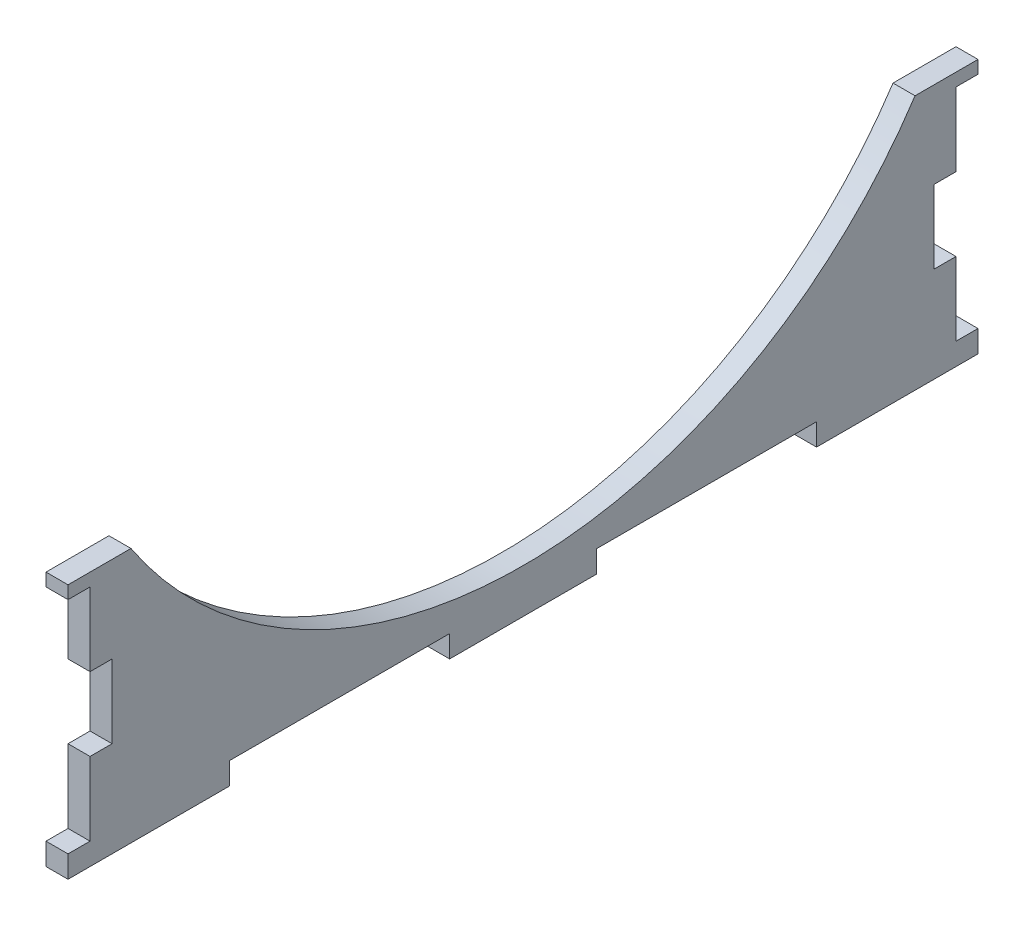
from build123d import *

# Parameters (mm, degrees)
IMPORTED_START          = -3
IMPORTED_BODY_4_1_DEPTH = 3
CUT_EXTRUDE_2_DEPTH     = 3


# Read off the part's stored shape, not the designer's step: 基体零件-零件4-1
with BuildPart() as part:
    # 基体零件-零件4-1 outline → 基体零件-零件4-1 (new body)
    with BuildSketch(Plane.YZ.offset(IMPORTED_START)):
        Polygon((-3, -3), (0, -3), (0, 0), (9.999598957, 0), (9.999598957, 3), (20.000401043, 3), (20.000401043, 0), (30, 0), (30, -3), (52, -3), (52, 0), (82, 0), (82, -3), (104, -3), (104, 19), (101, 19), (101, 49), (104, 49), (104, 69), (101, 69), (101, 99), (104, 99), (104, 121), (82, 121), (82, 118), (52, 118), (52, 121), (30, 121), (30, 118), (20.000401043, 118), (20.000401043, 115), (9.999598957, 115), (9.999598957, 118), (0, 118), (0, 121), (-3, 121), (-3, 99), (0, 99), (0, 69), (-3, 69), (-3, 49), (0, 49), (0, 19), (-3, 19), align=None)
    extrude(amount=IMPORTED_BODY_4_1_DEPTH)

    # 草图3 → 切除-拉伸2 (cut)
    with BuildSketch(Plane(origin=(0, 0, 0), x_dir=(0, 0, -1), z_dir=(1, 0, 0))):
        with BuildLine():
            Line((-121, 104), (3, 104))
            Line((3, 104), (3, 31.75415679))
            Line((3, 31.75415679), (-5.579680491, 31.75415679))
            ThreePointArc((-5.579680491, 31.75415679), (-59, 3), (-112.420319509, 31.75415679))
            Line((-112.420319509, 31.75415679), (-121, 31.75415679))
            Line((-121, 31.75415679), (-121, 104))
        make_face()
    extrude(amount=-CUT_EXTRUDE_2_DEPTH, mode=Mode.SUBTRACT)


solid = part.part
